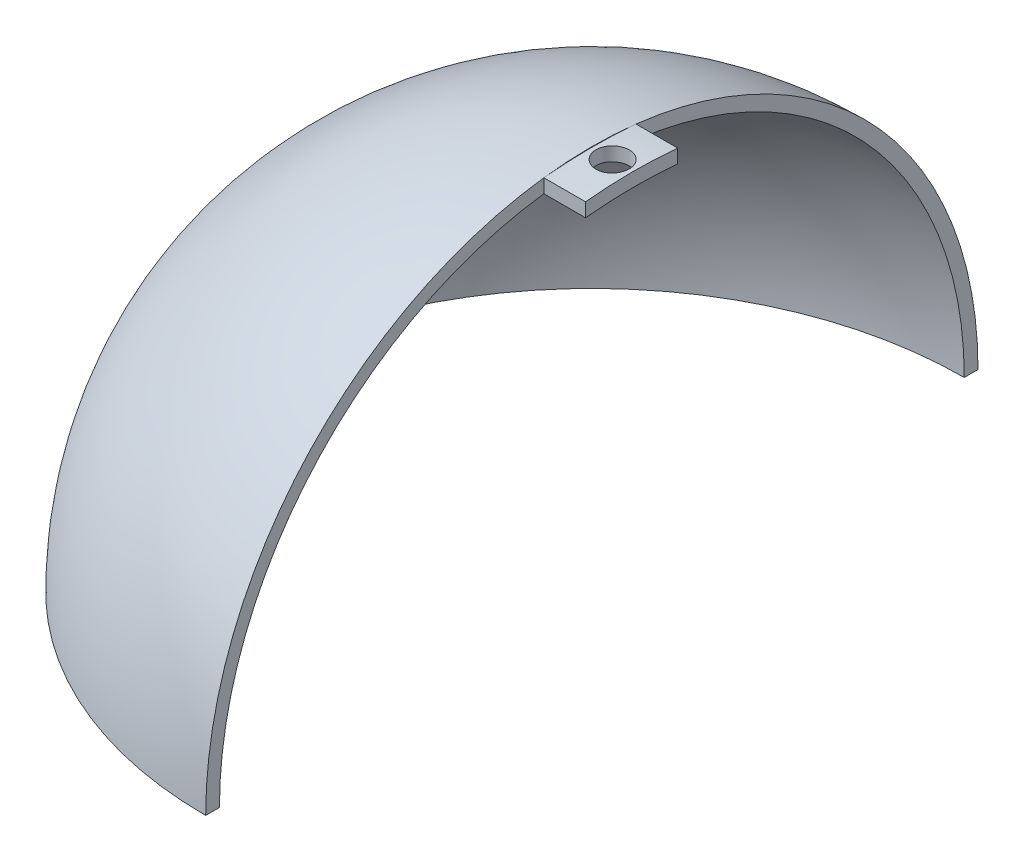
from build123d import *

# Parameters (mm, degrees)
REVOLVE1_ANGLE      = 90
BOSS_EXTRUDE1_DEPTH = 1000
SKETCH4_R           = 400
CUT_EXTRUDE1_DEPTH  = 9275


with BuildPart() as part:
    # Sketch1 → Revolve1 (revolve)
    with BuildSketch(Plane(origin=(0, 0, 0), x_dir=(1, 0, 0), z_dir=(0, 1, 0))):
        with BuildLine():
            Line((0, 9275), (0, 8945))
            ThreePointArc((0, 8945), (-8945, 0), (0, -8945))
            Line((0, -8945), (0, -9275))
            ThreePointArc((0, -9275), (-9275, 0), (0, 9275))
        make_face()
    revolve(axis=Axis((0, 0, 41.715398803), (0, 0, -1)), revolution_arc=REVOLVE1_ANGLE)

    # Sketch3 → Boss-Extrude1 (add)
    with BuildSketch(Plane(origin=(0, 0, 0), x_dir=(0, 0, -1), z_dir=(1, 0, 0))):
        with BuildLine():
            Line((-1151.759546419, 9203.210034941), (-1151.759546419, 8870.539721304))
            ThreePointArc((-1151.759546419, 8870.539721304), (-45.613079461, 8930.010478472), (1061.083188748, 8881.842571593))
            Line((1061.083188748, 8881.842571593), (1061.083188748, 9214.104810917))
            ThreePointArc((1061.083188748, 9214.104810917), (-45.598564643, 9261.544498629), (-1151.759546419, 9203.210034941))
        make_face()
    extrude(amount=BOSS_EXTRUDE1_DEPTH)

    # Sketch4 → Cut-Extrude1 (cut)
    with BuildSketch(Plane(origin=(0, 0, 0), x_dir=(1, 0, 0), z_dir=(0, 1, 0))):
        with Locations((500, 0)):
            Circle(SKETCH4_R)
    extrude(amount=CUT_EXTRUDE1_DEPTH, mode=Mode.SUBTRACT)


solid = part.part
